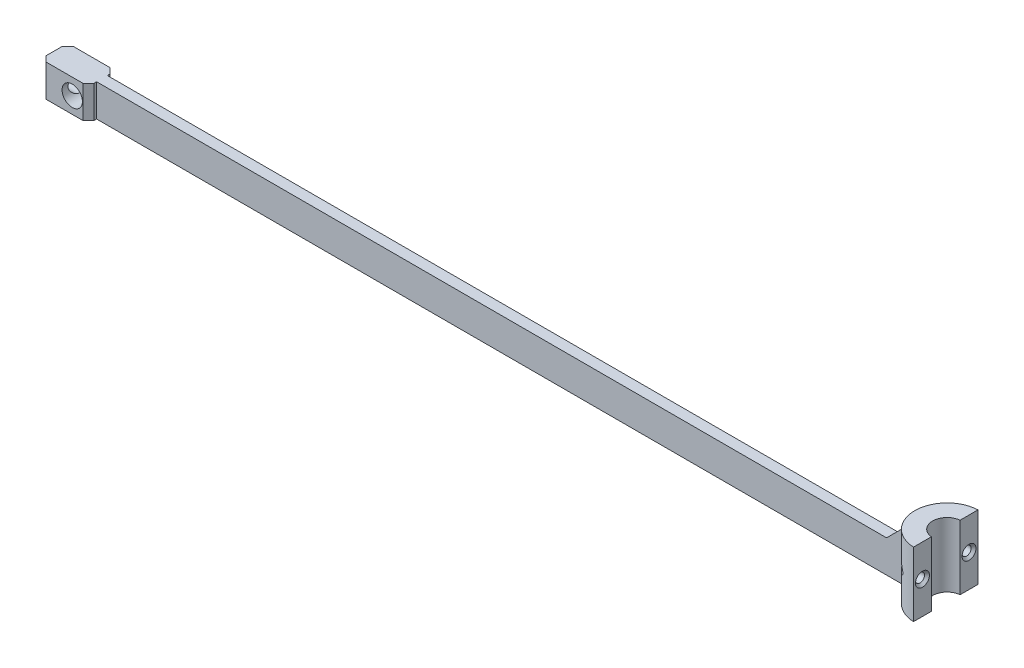
from build123d import *

# Parameters (mm, degrees)
SKETCH1_W                        = 254
SKETCH1_H                        = 3.175
BOSS_EXTRUDE1_DEPTH              = 9.525
BOSS_EXTRUDE2_DEPTH              = 19.05
SKETCH3_R                        = 4.25
CUT_EXTRUDE1_DEPTH               = 129.772942093
SKETCH4_W                        = 9.525
SKETCH4_H                        = 9.525
BOSS_EXTRUDE3_DEPTH              = 4
SKETCH5_R                        = 3
CUT_EXTRUDE2_DEPTH               = 134.81689298
CUT_EXTRUDE2_DRAFT               = 0.5
RIB1_REACH                       = 135.472
SKETCH7_WALL_W                   = 278.469391374
SKETCH7_WALL_H                   = 3.175
MOVE_FACE1_BY                    = 4.572
F_10_24_TAPPED_HOLE1_D           = 4.572
F_10_24_TAPPED_HOLE1_DEPTH       = 9.3335
F_10_24_TAPPED_HOLE1_CSINK_D     = 6.096
F_10_24_TAPPED_HOLE1_CSINK_ANGLE = 90
F_10_24_TAPPED_HOLE1_TIP         = 1.373567375
F_4_40_TAPPED_HOLE1_D            = 2.667
F_4_40_TAPPED_HOLE1_DEPTH        = 9.129125
F_4_40_TAPPED_HOLE1_CSINK_D      = 4.1148
F_4_40_TAPPED_HOLE1_CSINK_ANGLE  = 90
F_4_40_TAPPED_HOLE1_TIP          = 0.801247635
CHAMFER1_SIZE                    = 1.5875


with BuildPart() as part:
    # Sketch1 → Boss-Extrude1 (new body)
    with BuildSketch(Plane(origin=(0, 0, 0), x_dir=(1, 0, 0), z_dir=(0, 1, 0))):
        Rectangle(SKETCH1_W, SKETCH1_H)
    extrude(amount=BOSS_EXTRUDE1_DEPTH)

    # Sketch2 → Boss-Extrude2 (add)
    with BuildSketch(Plane(origin=(0, 0, 0), x_dir=(1, 0, 0), z_dir=(0, 1, 0))):
        with BuildLine():
            Line((126.603125, 9.516728179), (126.603125, -9.516728179))
            ThreePointArc((126.603125, -9.516728179), (117.475, 0), (126.603125, 9.516728179))
        make_face()
    extrude(amount=BOSS_EXTRUDE2_DEPTH)

    # Sketch3 → Cut-Extrude1 (cut, through all)
    with BuildSketch(Plane(origin=(0, 19.05, 0), x_dir=(1, 0, 0), z_dir=(0, 1, 0))):
        with Locations((127, 0)):
            Circle(SKETCH3_R)
    extrude(amount=-CUT_EXTRUDE1_DEPTH, mode=Mode.SUBTRACT)

    # Sketch4 → Boss-Extrude3 (add, symmetric)
    with BuildSketch(Plane.XY):
        with Locations((-127, 4.7625)):
            Rectangle(SKETCH4_W, SKETCH4_H)
    extrude(amount=BOSS_EXTRUDE3_DEPTH, both=True)


with BuildPart() as cut_extrude2_tool:
    # Sketch5 → Cut-Extrude2 (with draft: the straight prism first)
    with BuildSketch(Plane.XY.offset(4)):
        with Locations((-127, 4.7625)):
            Circle(SKETCH5_R)
    extrude(amount=-CUT_EXTRUDE2_DEPTH)
    # Cut-Extrude2: the draft: its side faces are tilted about the plane it starts from
    cut_extrude2_sides = [cut_extrude2_tool.faces().sort_by_distance(p)[0] for p in [
        (-130, 4.7625, -63.40844649),
    ]]
    draft(cut_extrude2_sides, Plane.XY.offset(4), CUT_EXTRUDE2_DRAFT)


with BuildPart() as part_1:
    add(part.part)

    # Cut-Extrude2: cut by cut_extrude2_tool
    add(cut_extrude2_tool.part, mode=Mode.SUBTRACT)

    # Sketch7 wall → Rib1 (add, up to next)
    with BuildSketch(Plane(origin=(114.107403955, 12.892596045, 0), x_dir=(0.707106781187, 0.707106781187, 0), z_dir=(-0.707106781187, 0.707106781187, 0)), mode=Mode.PRIVATE) as rib1_sk1:
        Rectangle(SKETCH7_WALL_W, SKETCH7_WALL_H)
    rib1_tool1 = extrude(rib1_sk1.sketch, amount=-RIB1_REACH, mode=Mode.PRIVATE) - part_1.part
    add(rib1_tool1.solids().sort_by_distance((114.107403955, 12.892596045, 0))[0])

    # Move Face1: a face moved outward by 4.572
    extrude(part_1.faces().sort_by_distance((-131.7625, 4.7625, 0))[0], amount=MOVE_FACE1_BY, dir=(-1, 0, 0))

    # #10-24 Tapped Hole1
    with Locations(Plane.ZY.offset(136.3345)):
        with Locations((0, 4.7625)):
            CounterSinkHole(F_10_24_TAPPED_HOLE1_D / 2, F_10_24_TAPPED_HOLE1_CSINK_D / 2, depth=F_10_24_TAPPED_HOLE1_DEPTH, counter_sink_angle=F_10_24_TAPPED_HOLE1_CSINK_ANGLE)
            with Locations((0, 0, -(F_10_24_TAPPED_HOLE1_DEPTH + F_10_24_TAPPED_HOLE1_TIP / 2))):  # 118° drill point
                Cone(0, F_10_24_TAPPED_HOLE1_D / 2, F_10_24_TAPPED_HOLE1_TIP, mode=Mode.SUBTRACT)

    # #4-40 Tapped Hole1
    with Locations(Plane(origin=(126.603125, 0, 0), x_dir=(0, 0, -1), z_dir=(1, 0, 0))):
        with Locations((-6.874078522, 9.525), (6.874078522, 9.525)):
            CounterSinkHole(F_4_40_TAPPED_HOLE1_D / 2, F_4_40_TAPPED_HOLE1_CSINK_D / 2, depth=F_4_40_TAPPED_HOLE1_DEPTH, counter_sink_angle=F_4_40_TAPPED_HOLE1_CSINK_ANGLE)
            with Locations((0, 0, -(F_4_40_TAPPED_HOLE1_DEPTH + F_4_40_TAPPED_HOLE1_TIP / 2))):  # 118° drill point
                Cone(0, F_4_40_TAPPED_HOLE1_D / 2, F_4_40_TAPPED_HOLE1_TIP, mode=Mode.SUBTRACT)

    # Chamfer1
    # the kernel refuses this chamfer: 1.93751941, 1.5875 mm, written as the material it adds along each edge
    with BuildSketch(Plane(origin=(117.608223344, 0, -1.5875), x_dir=(-1, 0, 0), z_dir=(0, 1, 0))) as chamfer1_piece_1_section:
        with BuildLine():
            Line((CHAMFER1_SIZE, 0), (-0.683137079, -2.270637079))
            ThreePointArc((-0.683137079, -2.270637079), (-0.280625297, -1.189647084), (0, 0))
            Line((0, 0), (CHAMFER1_SIZE, 0))
        make_face()
    chamfer1_piece_1 = extrude(amount=22.492706814, mode=Mode.PRIVATE)
    chamfer1_piece_1 = split(chamfer1_piece_1, bisect_by=Plane(origin=(109.411515627, 8.196707717, -1.5875), z_dir=(0.7071067811865476, -0.7071067811865476, 0)), keep=Keep.TOP, mode=Mode.PRIVATE)
    add(chamfer1_piece_1)
    with BuildSketch(Plane(origin=(117.608223344, 22.492706814, 1.5875), x_dir=(-1, 0, 0), z_dir=(0, -1, 0))) as chamfer1_piece_2_section:
        with BuildLine():
            Line((CHAMFER1_SIZE, 0), (-0.683137079, -2.270637079))
            ThreePointArc((-0.683137079, -2.270637079), (-0.280625297, -1.189647084), (0, 0))
            Line((0, 0), (CHAMFER1_SIZE, 0))
        make_face()
    chamfer1_piece_2 = extrude(amount=22.492706814, mode=Mode.PRIVATE)
    chamfer1_piece_2 = split(chamfer1_piece_2, bisect_by=Plane(origin=(120.657869034, 19.443061124, 1.5875), z_dir=(0.7071067811865476, -0.7071067811865476, 0)), keep=Keep.TOP, mode=Mode.PRIVATE)
    add(chamfer1_piece_2)
    # the kernel refuses this chamfer: 1.93751941, 1.5875 mm, written as the material it takes off along each edge
    with BuildSketch(Plane(origin=(-122.2375, -4.082546743, -4), x_dir=(0, 0, 1), z_dir=(0, 1, 0)), Plane(origin=(-122.2375, -4.082546743, 4), x_dir=(-1, 0, 0), z_dir=(0, 1, 0))) as chamfer1_2_piece_1:
        Polygon((CHAMFER1_SIZE, 0), (0, -CHAMFER1_SIZE), (0, 0), align=None)
    extrude(amount=17.690093487, mode=Mode.SUBTRACT)
    with BuildSketch(Plane(origin=(-136.3345, 13.607546743, -4), x_dir=(1, 0, 0), z_dir=(0, -1, 0)), Plane(origin=(-136.3345, 13.607546743, 4), x_dir=(0, 0, -1), z_dir=(0, -1, 0))) as chamfer1_2_piece_2:
        Polygon((CHAMFER1_SIZE, 0), (0, CHAMFER1_SIZE), (0, 0), align=None)
    extrude(amount=17.690093487, mode=Mode.SUBTRACT)


solid = part_1.part
